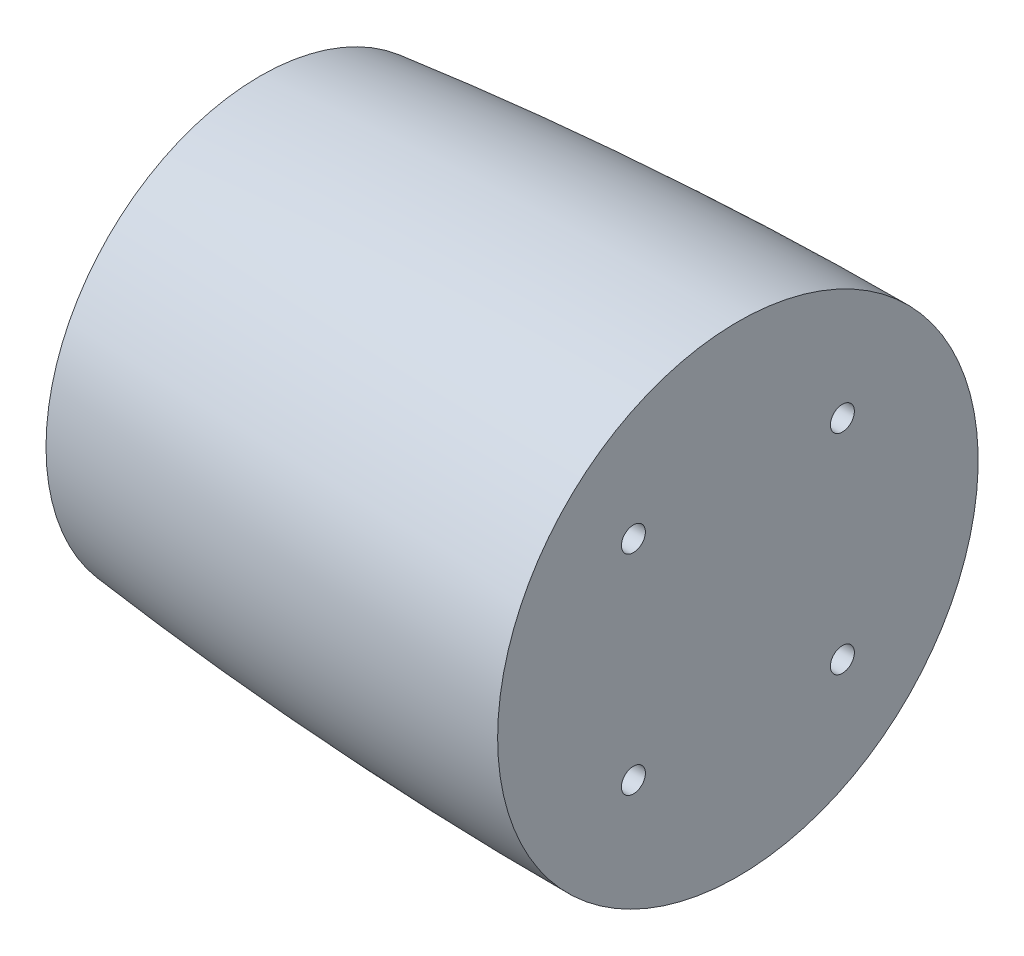
from build123d import *

# Parameters (mm, degrees)
F_1_4_20_TAPPED_HOLE1_D = 5.1054


with BuildPart() as part:
    # Sketch1 → Revolve1 (revolve)
    with BuildSketch(Plane.XY):
        with BuildLine():
            Line((0, 0), (101.6, 0))
            Line((101.6, 0), (101.6, 51.104805069))
            add(Edge.make_bspline(
                [(0, 45.565336911), (11.288888889, 46.799998961), (22.577777778, 47.878482167), (33.866666667, 48.801587173), (45.155555556, 49.569973204), (56.444444444, 50.184162996), (67.733333333, 50.644546343), (79.022222222, 50.951382485), (90.311111111, 51.104801499), (101.6, 51.104805069)],
                knots=[0.082969854, 0.082969854, 0.082969854, 0.082969854, 0.082969854, 0.082969854, 0.082969854, 0.082969854, 0.082969854, 0.082969854, 0.916633623, 0.916633623, 0.916633623, 0.916633623, 0.916633623, 0.916633623, 0.916633623, 0.916633623, 0.916633623, 0.916633623], degree=9))
            Line((0, 45.565336911), (0, 0))
        make_face()
    revolve(axis=Axis((0, 0, 0), (1, 0, 0)))

    # 1/4-20 Tapped Hole1 (through all)
    with Locations(Plane(origin=(101.6, 0, 0), x_dir=(0, 0, -1), z_dir=(1, 0, 0))):
        with Locations((-22.225, 22.225), (22.225, 22.225), (22.225, -22.225), (-22.225, -22.225)):
            Hole(F_1_4_20_TAPPED_HOLE1_D / 2)


solid = part.part
